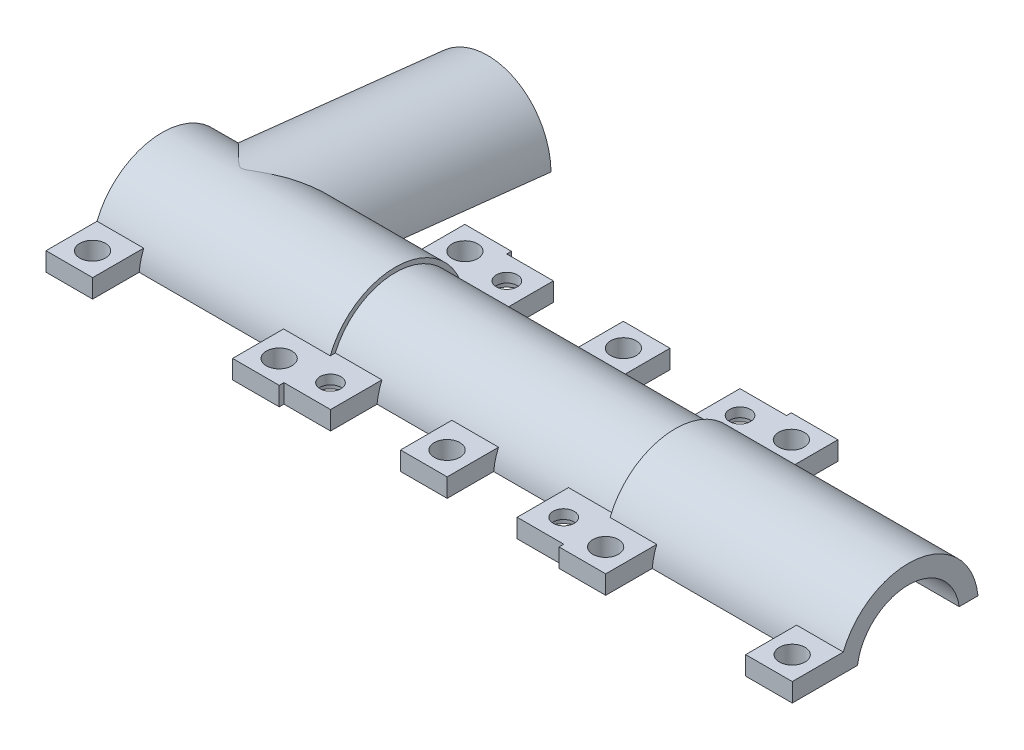
from build123d import *

# Parameters (mm, degrees)
BOSS_EXTRUDE2_DEPTH      = 30
SKETCH2_W                = 10
SKETCH2_H                = 14
SKETCH2_R                = 2.25
SKETCH2_R_2              = 2.75
BOSS_EXTRUDE3_DEPTH      = 4
SKETCH6_R                = 4
CUT_EXTRUDE1_DEPTH       = 2
BOSS_EXTRUDE4_DEPTH      = 50
SKETCH8_W                = 10
SKETCH8_H                = 14
SKETCH8_R                = 2.75
BOSS_EXTRUDE5_DEPTH      = 4
BOSS_EXTRUDE6_REACH      = 165.73
BOSS_EXTRUDE6_END_RADIUS = 15


with BuildPart() as part:
    # Sketch1 → Boss-Extrude2 (new, symmetric)
    with BuildSketch(Plane(origin=(0, 0, 0), x_dir=(0, 0, -1), z_dir=(1, 0, 0))):
        with BuildLine():
            Line((-13.919410907, 1.5), (-9.886859967, 1.5))
            ThreePointArc((-9.886859967, 1.5), (0, 10), (9.886859967, 1.5))
            Line((9.886859967, 1.5), (13.919410907, 1.5))
            ThreePointArc((13.919410907, 1.5), (0, 14), (-13.919410907, 1.5))
        make_face()
    extrude(amount=BOSS_EXTRUDE2_DEPTH, both=True)

    # Sketch2 → Boss-Extrude3 (add)
    # profile 1 of 6: a face of its own
    with BuildSketch(Plane.XZ.offset(-1.5)):
        with Locations((-25, -16.886859967)):
            Rectangle(SKETCH2_W, SKETCH2_H)
        with Locations((-25, -18.903135437)):
            Circle(SKETCH2_R, mode=Mode.SUBTRACT)
    # profile 2 of 6: a face of its own
    with BuildSketch(Plane.XZ.offset(-1.5)):
        with Locations((25, -16.886859967)):
            Rectangle(SKETCH2_W, SKETCH2_H)
        with Locations((25, -18.903135437)):
            Circle(SKETCH2_R, mode=Mode.SUBTRACT)
    # profile 3 of 6: a face of its own
    with BuildSketch(Plane.XZ.offset(-1.5)):
        with Locations((-25, 16.886859967)):
            Rectangle(SKETCH2_W, SKETCH2_H)
        with Locations((-25, 18.903135437)):
            Circle(SKETCH2_R, mode=Mode.SUBTRACT)
    # profile 4 of 6: a face of its own
    with BuildSketch(Plane.XZ.offset(-1.5)):
        with Locations((25, 16.886859967)):
            Rectangle(SKETCH2_W, SKETCH2_H)
        with Locations((25, 18.903135437)):
            Circle(SKETCH2_R, mode=Mode.SUBTRACT)
    # profile 5 of 6: a face of its own
    with BuildSketch(Plane.XZ.offset(-1.5)):
        with Locations((0, 16.886859967)):
            Rectangle(SKETCH2_W, SKETCH2_H)
        with Locations((0, 18.903135437)):
            Circle(SKETCH2_R_2, mode=Mode.SUBTRACT)
    # profile 6 of 6: a face of its own
    with BuildSketch(Plane.XZ.offset(-1.5)):
        with Locations((0, -16.886859967)):
            Rectangle(SKETCH2_W, SKETCH2_H)
        with Locations((0, -18.903135437)):
            Circle(SKETCH2_R_2, mode=Mode.SUBTRACT)
    extrude(amount=-BOSS_EXTRUDE3_DEPTH)

    # Sketch6 → Cut-Extrude1 (cut)
    with BuildSketch(Plane.XZ.offset(-1.5)):
        with Locations((-25, 18.903135437)):
            Circle(SKETCH6_R)
        with Locations((25, -18.903135437)):
            Circle(SKETCH6_R)
        with Locations((-25, -18.903135437)):
            Circle(SKETCH6_R)
        with Locations((25, 18.903135437)):
            Circle(SKETCH6_R)
    extrude(amount=-CUT_EXTRUDE1_DEPTH, mode=Mode.SUBTRACT)

    # Sketch7 → Boss-Extrude4 (add)
    with BuildSketch(Plane.ZY.offset(30)):
        with BuildLine():
            Line((-14.924811557, 1.5), (-10.897247359, 1.5))
            ThreePointArc((-10.897247359, 1.5), (0, 11), (10.897247359, 1.5))
            Line((10.897247359, 1.5), (14.924811557, 1.5))
            ThreePointArc((14.924811557, 1.5), (0, 15), (-14.924811557, 1.5))
        make_face()
    boss_extrude4 = extrude(amount=BOSS_EXTRUDE4_DEPTH)

    # Sketch8 → Boss-Extrude5 (add)
    # profile 1 of 3: a face of its own
    with BuildSketch(Plane.XZ.offset(-1.5)):
        with Locations((-75, 17.897247359)):
            Rectangle(SKETCH8_W, SKETCH8_H)
        with Locations((-75, 19.911029458)):
            Circle(SKETCH8_R, mode=Mode.SUBTRACT)
    # profile 2 of 3: a face of its own
    with BuildSketch(Plane.XZ.offset(-1.5)):
        with Locations((-35, 17.897247359)):
            Rectangle(SKETCH8_W, SKETCH8_H)
        with Locations((-35, 19.911029458)):
            Circle(SKETCH8_R, mode=Mode.SUBTRACT)
    # profile 3 of 3: a face of its own
    with BuildSketch(Plane.XZ.offset(-1.5)):
        with Locations((-35, -17.897247359)):
            Rectangle(SKETCH8_W, SKETCH8_H)
        with Locations((-35, -19.911029458)):
            Circle(SKETCH8_R, mode=Mode.SUBTRACT)
    boss_extrude5 = extrude(amount=-BOSS_EXTRUDE5_DEPTH)

    # Mirror1: Boss-Extrude4, Boss-Extrude5 across plane
    add(boss_extrude4.mirror(Plane(origin=(0, 0, 0), x_dir=(0, 0, 1), z_dir=(1, 0, 0))))
    add(boss_extrude5.mirror(Plane(origin=(0, 0, 0), x_dir=(0, 0, 1), z_dir=(1, 0, 0))))

    # Boss-Extrude6: up to this cylinder (the profile starts outside it)
    boss_extrude6_end = Plane(origin=(-75.968444, 0, 0), z_dir=(1, 0, 0)) * Cylinder(BOSS_EXTRUDE6_END_RADIUS, 362.46, mode=Mode.PRIVATE)
    # Sketch13 → Boss-Extrude6 (add, up to the surface)
    with BuildSketch(Plane(origin=(-63.175856798, -3.935085341, -52.236626748), x_dir=(-0.9993795737443293, 0.002731395695131188, -0.03511420026370482), z_dir=(0.03479191320128619, -0.07845909572784512, -0.9963100386292226)), mode=Mode.PRIVATE) as boss_extrude6_sk1:
        with BuildLine():
            Line((10.897247359, 1.5), (14.723790273, 1.5))
            ThreePointArc((14.723790273, 1.5), (0, 14.8), (-14.723790273, 1.5))
            Line((-14.723790273, 1.5), (-10.897247359, 1.5))
            ThreePointArc((-10.897247359, 1.5), (0, 11), (10.897247359, 1.5))
        make_face()
    boss_extrude6_tool1 = extrude(boss_extrude6_sk1.sketch, amount=-BOSS_EXTRUDE6_REACH, mode=Mode.PRIVATE) - boss_extrude6_end
    add(boss_extrude6_tool1.solids().sort_by_distance((-75.968444, -2.082604, -52.829236))[0])


solid = part.part
